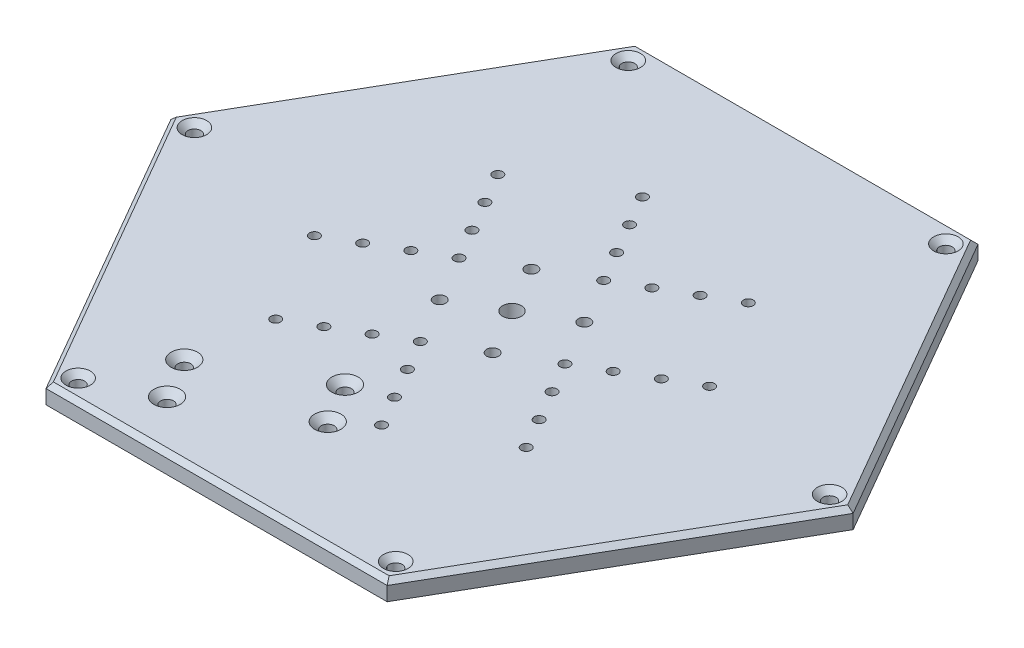
from build123d import *

# Parameters (mm, degrees)
BOSS_EXTRUDE1_DEPTH                             = 8
CSK_FOR_M5_FLAT_HEAD_MACHINE_SCREW2_D           = 5.5
CSK_FOR_M5_FLAT_HEAD_MACHINE_SCREW2_DEPTH       = 10
CSK_FOR_M5_FLAT_HEAD_MACHINE_SCREW2_CSINK_D     = 10.4
CSK_FOR_M5_FLAT_HEAD_MACHINE_SCREW2_CSINK_ANGLE = 90
CSK_FOR_M5_FLAT_HEAD_MACHINE_SCREW2_TIP         = 1.652366702
CHAMFER4_SIZE                                   = 2
CSK_FOR_M5_SFHCS1_D                             = 5.5
CSK_FOR_M5_SFHCS1_DEPTH                         = 10
CSK_FOR_M5_SFHCS1_CSINK_D                       = 11.2
CSK_FOR_M5_SFHCS1_CSINK_ANGLE                   = 90
CSK_FOR_M5_SFHCS1_TIP                           = 1.652366702
M5X0_8_TAPPED_HOLE1_D                           = 4.2
F_1_4_20_TAPPED_HOLE1_D                         = 5.1054
F_3_8_16_TAPPED_HOLE1_D                         = 7.9375


with BuildPart() as part:
    # Sketch1 → Boss-Extrude1 (new body)
    with BuildSketch(Plane(origin=(0, 0, 0), x_dir=(1, 0, 0), z_dir=(0, 1, 0))):
        Polygon((72.5, 125.573683549), (-72.5, 125.573683549), (-145, 0), (-72.5, -125.573683549), (72.5, -125.573683549), (145, 0), align=None)
    extrude(amount=BOSS_EXTRUDE1_DEPTH)

    # CSK for M5 Flat Head Machine Screw2
    with Locations(Plane(origin=(0, 8, 0), x_dir=(1, 0, 0), z_dir=(0, 1, 0))):
        with Locations((-135, 0), (-67.5, -116.913429511), (67.5, -116.913429511), (135, 0), (67.5, 116.913429511), (-67.5, 116.913429511)):
            CounterSinkHole(CSK_FOR_M5_FLAT_HEAD_MACHINE_SCREW2_D / 2, CSK_FOR_M5_FLAT_HEAD_MACHINE_SCREW2_CSINK_D / 2, depth=CSK_FOR_M5_FLAT_HEAD_MACHINE_SCREW2_DEPTH, counter_sink_angle=CSK_FOR_M5_FLAT_HEAD_MACHINE_SCREW2_CSINK_ANGLE)
            with Locations((0, 0, -(CSK_FOR_M5_FLAT_HEAD_MACHINE_SCREW2_DEPTH + CSK_FOR_M5_FLAT_HEAD_MACHINE_SCREW2_TIP / 2))):  # 118° drill point
                Cone(0, CSK_FOR_M5_FLAT_HEAD_MACHINE_SCREW2_D / 2, CSK_FOR_M5_FLAT_HEAD_MACHINE_SCREW2_TIP, mode=Mode.SUBTRACT)

    # Chamfer4
    chamfer4_edges = [part.edges().sort_by_distance(p)[0] for p in [
        (0, 8, 125.573683549),
        (108.75, 8, 62.786841774),
        (108.75, 8, -62.786841774),
        (0, 8, -125.573683549),
        (-108.75, 8, -62.786841774),
        (-108.75, 8, 62.786841774),
    ]]
    chamfer(chamfer4_edges, length=CHAMFER4_SIZE)

    # CSK for M5 SFHCS1
    with Locations(Plane(origin=(0, 8, 0), x_dir=(1, 0, 0), z_dir=(0, 1, 0))):
        with Locations((1.594210129, -79.908620039), (-8.405789871, -62.588111964), (-51.70706006, -87.588111964), (-41.70706006, -104.908620039)):
            CounterSinkHole(CSK_FOR_M5_SFHCS1_D / 2, CSK_FOR_M5_SFHCS1_CSINK_D / 2, depth=CSK_FOR_M5_SFHCS1_DEPTH, counter_sink_angle=CSK_FOR_M5_SFHCS1_CSINK_ANGLE)
            with Locations((0, 0, -(CSK_FOR_M5_SFHCS1_DEPTH + CSK_FOR_M5_SFHCS1_TIP / 2))):  # 118° drill point
                Cone(0, CSK_FOR_M5_SFHCS1_D / 2, CSK_FOR_M5_SFHCS1_TIP, mode=Mode.SUBTRACT)

    # M5x0.8 Tapped Hole1 (through all)
    with Locations(Plane(origin=(0, 8, 0), x_dir=(1, 0, 0), z_dir=(0, 1, 0))):
        with Locations((47.206714755, 53.235571585), (69.706714755, 14.264428415), (56.716333699, 6.764428415), (34.216333699, 45.735571585), (21.225952642, 38.235571585), (43.725952642, -0.735571585), (38.235571585, -21.225952642), (45.735571585, -34.216333699), (53.235571585, -47.206714755), (14.264428415, -69.706714755), (6.764428415, -56.716333699), (-0.735571585, -43.725952642), (-8.235571585, -30.735571585), (-30.735571585, 8.235571585), (8.235571585, 30.735571585), (30.735571585, -8.235571585), (0.735571585, 43.725952642), (-6.764428415, 56.716333699), (-14.264428415, 69.706714755), (-53.235571585, 47.206714755), (-45.735571585, 34.216333699), (-38.235571585, 21.225952642), (-43.725952642, 0.735571585), (-56.716333699, -6.764428415), (-69.706714755, -14.264428415), (-47.206714755, -53.235571585), (-34.216333699, -45.735571585), (-21.225952642, -38.235571585)):
            Hole(M5X0_8_TAPPED_HOLE1_D / 2)

    # 1/4-20 Tapped Hole1 (through all)
    with Locations(Plane(origin=(0, 8, 0), x_dir=(1, 0, 0), z_dir=(0, 1, 0))):
        with Locations((19.485571585, 11.25), (-11.25, 19.485571585), (-19.485571585, -11.25), (11.25, -19.485571585)):
            Hole(F_1_4_20_TAPPED_HOLE1_D / 2)

    # 3/8-16 Tapped Hole1 (through all)
    with Locations(Plane(origin=(0, 8, 0), x_dir=(1, 0, 0), z_dir=(0, 1, 0))):
        with Locations((0, 0)):
            Hole(F_3_8_16_TAPPED_HOLE1_D / 2)


solid = part.part
